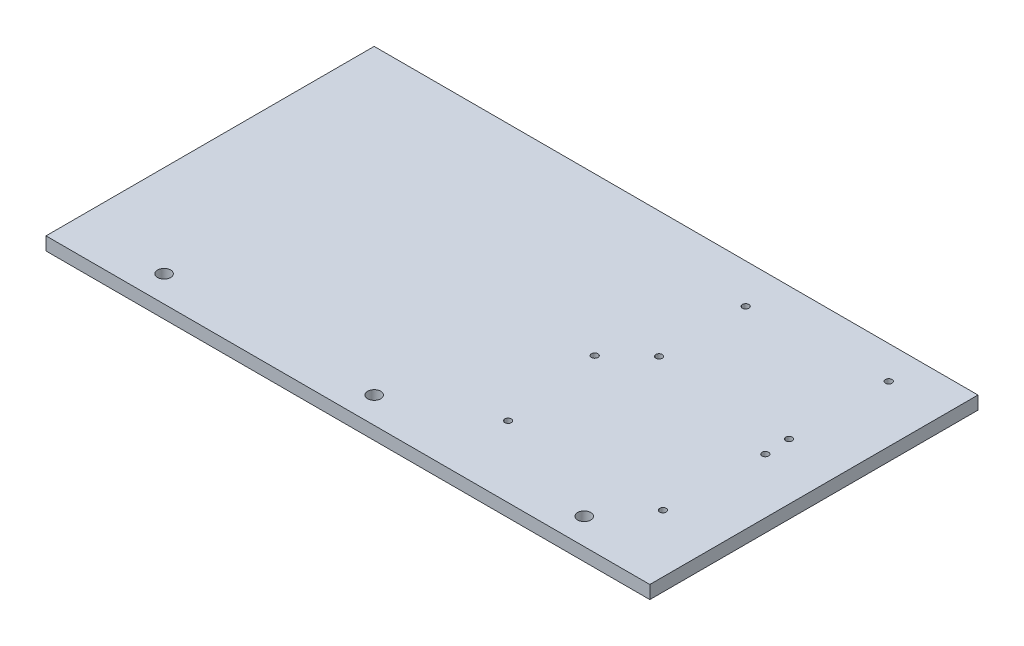
from build123d import *

# Parameters (mm, degrees)
SKETCH1_W           = 292.1
SKETCH1_H           = 158.75
BOSS_EXTRUDE1_DEPTH = 6.35
SKETCH2_R           = 3.175
CUT_EXTRUDE2_DEPTH  = 6.35
SKETCH4_R           = 1.5875
CUT_EXTRUDE3_DEPTH  = 333.512097524


with BuildPart() as part:
    # Sketch1 → Boss-Extrude1 (new body)
    with BuildSketch(Plane(origin=(0, 0, 0), x_dir=(1, 0, 0), z_dir=(0, 1, 0))):
        with Locations((146.05, 79.375)):
            Rectangle(SKETCH1_W, SKETCH1_H)
    extrude(amount=BOSS_EXTRUDE1_DEPTH)

    # Sketch2 → Cut-Extrude2 (cut)
    with BuildSketch(Plane(origin=(0, 6.35, 0), x_dir=(1, 0, 0), z_dir=(0, 1, 0))):
        with Locations((146.05, 12.7)):
            Circle(SKETCH2_R)
        with Locations((247.65, 12.7)):
            Circle(SKETCH2_R)
        with Locations((44.45, 12.7)):
            Circle(SKETCH2_R)
    extrude(amount=-CUT_EXTRUDE2_DEPTH, mode=Mode.SUBTRACT)

    # Sketch4 → Cut-Extrude3 (cut, through all)
    with BuildSketch(Plane(origin=(0, 6.35, 0), x_dir=(1, 0, 0), z_dir=(0, 1, 0))):
        with Locations((182.88, 82.55)):
            Circle(SKETCH4_R)
        with Locations((189.23, 34.29)):
            Circle(SKETCH4_R)
        with Locations((265.43, 82.55)):
            Circle(SKETCH4_R)
        with Locations((264.16, 34.29)):
            Circle(SKETCH4_R)
        with Locations((264.795, 142.875)):
            Circle(SKETCH4_R)
        with Locations((264.795, 94.615)):
            Circle(SKETCH4_R)
        with Locations((198.755, 97.79)):
            Circle(SKETCH4_R)
        with Locations((198.755, 139.7)):
            Circle(SKETCH4_R)
    extrude(amount=-CUT_EXTRUDE3_DEPTH, mode=Mode.SUBTRACT)


solid = part.part
